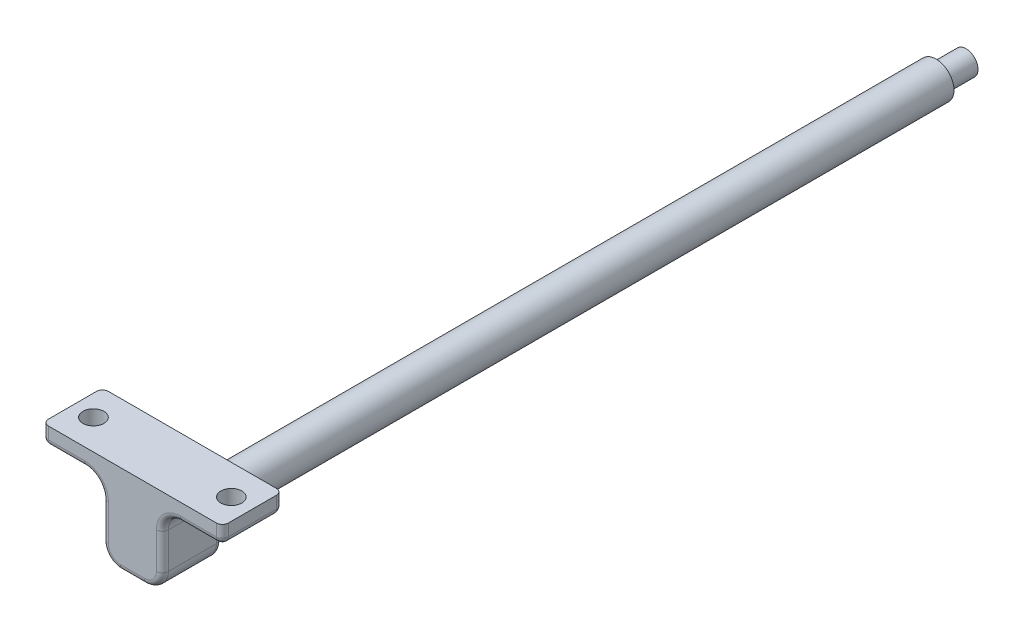
from build123d import *

# Parameters (mm, degrees)
SKETCH_1_R          = 3
EXTRUDE_1_DEPTH     = 124
SKETCH_2_R          = 2
EXTRUDE_2_DEPTH     = 5
SKETCH_4_W          = 10
SKETCH_4_H          = 3
EXTRUDE_4_DEPTH     = 10
FILLET_6_R          = 3
FILLET_7_R          = 1
SKETCH_5_R          = 1.75
CUT_EXTRUDE_1_DEPTH = 136.369863806
FILLET_8_R          = 1


with BuildPart() as part:
    # ｽｹｯﾁ1 → ﾎﾞｽ - 押し出し1 (new body)
    with BuildSketch(Plane.XY):
        Circle(SKETCH_1_R)
    extrude(amount=EXTRUDE_1_DEPTH)

    # ｽｹｯﾁ2 → ﾎﾞｽ - 押し出し2 (add)
    with BuildSketch(Plane(origin=(0, 0, 0), x_dir=(-1, 0, 0), z_dir=(0, 0, -1))):
        with Locations(Location((0, 0, 0), (0, 0, 180))):
            Circle(SKETCH_2_R)
    extrude(amount=EXTRUDE_2_DEPTH)


with BuildPart() as body_2:
    # ｽｹｯﾁ4 → ﾎﾞｽ - 押し出し4 (new body)
    with BuildSketch(Plane.XY.offset(124)):
        with Locations((10, 8.5)):
            Rectangle(SKETCH_4_W, SKETCH_4_H)
        with BuildLine():
            Line((5, 10), (0, 10))
            Line((0, 10), (0, 3))
            ThreePointArc((0, 3), (2.121320344, 2.121320344), (3, 0))
            ThreePointArc((3, 0), (2.121320344, -2.121320344), (0, -3))
            Line((0, -3), (0, -5))
            Line((0, -5), (5, -5))
            Line((5, -5), (5, 7))
            Line((5, 7), (5, 10))
        make_face()
        with BuildLine():
            Line((0, 3), (0, 10))
            Line((0, 10), (-5, 10))
            Line((-5, 10), (-5, 7))
            Line((-5, 7), (-5, -5))
            Line((-5, -5), (0, -5))
            Line((0, -5), (0, -3))
            ThreePointArc((0, -3), (-3, 0), (0, 3))
        make_face()
        with Locations((-10, 8.5)):
            Rectangle(SKETCH_4_W, SKETCH_4_H)
        with BuildLine():
            ThreePointArc((3, 0), (2.121320344, 2.121320344), (0, 3))
            Line((0, 3), (0, -3))
            ThreePointArc((0, -3), (2.121320344, -2.121320344), (3, 0))
        make_face()
        with BuildLine():
            Line((0, -3), (0, 3))
            ThreePointArc((0, 3), (-3, 0), (0, -3))
        make_face()
    extrude(amount=EXTRUDE_4_DEPTH)

    # ﾌｨﾚｯﾄ6
    fillet_6_edges = [body_2.edges().sort_by_distance(p)[0] for p in [
        (5, 7, 129),
        (5, -5, 129),
        (-5, -5, 129),
        (-5, 7, 129),
    ]]
    fillet(fillet_6_edges, radius=FILLET_6_R)

    # ﾌｨﾚｯﾄ7
    fillet_7_edges = [body_2.edges().sort_by_distance(p)[0] for p in [
        (15, 7, 129),
        (-15, 7, 129),
        (11.5, 7, 124),
        (11.5, 7, 134),
        (5, 1, 124),
        (5, 1, 134),
        (-5, 1, 124),
        (-5, 1, 134),
        (-11.5, 7, 124),
        (-11.5, 7, 134),
        (0, -5, 124),
        (-4.121320344, -4.121320344, 124),
        (4.121320344, -4.121320344, 124),
        (0, -5, 134),
        (-4.121320344, -4.121320344, 134),
        (4.121320344, -4.121320344, 134),
        (5.878679656, 6.121320344, 124),
        (5.878679656, 6.121320344, 134),
        (-5.878679656, 6.121320344, 124),
        (-5.878679656, 6.121320344, 134),
    ]]
    fillet(fillet_7_edges, radius=FILLET_7_R)

    # ｽｹｯﾁ5 → ｶｯﾄ - 押し出し1 (cut, through all)
    with BuildSketch(Plane(origin=(0, 7, 0), x_dir=(-1, 0, 0), z_dir=(0, -1, 0))):
        with Locations(Location((-11.5, -129, 0), (0, 0, 90))):
            Circle(SKETCH_5_R)
        with Locations(Location((11.5, -129, 0), (0, 0, 90))):
            Circle(SKETCH_5_R)
    extrude(amount=-CUT_EXTRUDE_1_DEPTH, mode=Mode.SUBTRACT)

    # ﾌｨﾚｯﾄ8
    # the kernel refuses this fillet: 1 mm, written as the material it takes off along each edge
    with BuildSketch(Plane(origin=(14, 8, 125), x_dir=(1, 0, 0), z_dir=(0, 0, -1))) as fillet_8_piece_1_section:
        Polygon((0, 0), (FILLET_8_R, 0), (FILLET_8_R, FILLET_8_R), (0, FILLET_8_R), align=None)
    fillet_8_piece_1 = extrude(amount=FILLET_8_R, mode=Mode.PRIVATE)
    fillet_8_piece_1 = fillet_8_piece_1 - Plane(origin=(14, 8, 125), x_dir=(-0.7071067811865472, 0.7071067811865477, 0), z_dir=(0, 0, -1)) * Sphere(FILLET_8_R, mode=Mode.PRIVATE)
    add(fillet_8_piece_1, mode=Mode.SUBTRACT)
    with BuildSketch(Plane(origin=(14, 8, 133), x_dir=(1, 0, 0), z_dir=(0, 0, 1))) as fillet_8_piece_2_section:
        Polygon((0, 0), (FILLET_8_R, 0), (FILLET_8_R, -FILLET_8_R), (0, -FILLET_8_R), align=None)
    fillet_8_piece_2 = extrude(amount=FILLET_8_R, mode=Mode.PRIVATE)
    fillet_8_piece_2 = fillet_8_piece_2 - Plane(origin=(14, 8, 133), x_dir=(-0.7071067811865472, 0.7071067811865477, 0), z_dir=(0, 0, 1)) * Sphere(FILLET_8_R, mode=Mode.PRIVATE)
    add(fillet_8_piece_2, mode=Mode.SUBTRACT)
    with BuildSketch(Plane(origin=(-14, 8, 125), x_dir=(-1, 0, 0), z_dir=(0, 0, -1))) as fillet_8_piece_3_section:
        Polygon((0, 0), (FILLET_8_R, 0), (FILLET_8_R, -FILLET_8_R), (0, -FILLET_8_R), align=None)
    fillet_8_piece_3 = extrude(amount=FILLET_8_R, mode=Mode.PRIVATE)
    fillet_8_piece_3 = fillet_8_piece_3 - Plane(origin=(-14, 8, 125), x_dir=(0.7071067811865472, 0.7071067811865477, 0), z_dir=(0, 0, -1)) * Sphere(FILLET_8_R, mode=Mode.PRIVATE)
    add(fillet_8_piece_3, mode=Mode.SUBTRACT)
    with BuildSketch(Plane(origin=(-14, 8, 133), x_dir=(-1, 0, 0), z_dir=(0, 0, 1))) as fillet_8_piece_4_section:
        Polygon((0, 0), (FILLET_8_R, 0), (FILLET_8_R, FILLET_8_R), (0, FILLET_8_R), align=None)
    fillet_8_piece_4 = extrude(amount=FILLET_8_R, mode=Mode.PRIVATE)
    fillet_8_piece_4 = fillet_8_piece_4 - Plane(origin=(-14, 8, 133), x_dir=(0.7071067811865472, 0.7071067811865477, 0), z_dir=(0, 0, 1)) * Sphere(FILLET_8_R, mode=Mode.PRIVATE)
    add(fillet_8_piece_4, mode=Mode.SUBTRACT)
    with BuildSketch(Plane(origin=(-15, 12.5, 124), x_dir=(1, 0, 0), z_dir=(0, -1, 0)), Plane(origin=(15, 8, 124), x_dir=(-1, 0, 0), z_dir=(0, 1, 0))) as fillet_8_piece_5:
        with BuildLine():
            CenterArc((FILLET_8_R, FILLET_8_R), FILLET_8_R, 180, 90)
            Line((0, FILLET_8_R), (0, 0))
            Line((0, 0), (FILLET_8_R, 0))
        make_face()
    extrude(amount=4.5, mode=Mode.SUBTRACT)
    with BuildSketch(Plane(origin=(-15, 12.5, 134), x_dir=(1, 0, 0), z_dir=(0, -1, 0)), Plane(origin=(15, 8, 134), x_dir=(-1, 0, 0), z_dir=(0, 1, 0))) as fillet_8_piece_6:
        with BuildLine():
            CenterArc((FILLET_8_R, -FILLET_8_R), FILLET_8_R, 90, 90)
            Line((0, -FILLET_8_R), (0, 0))
            Line((0, 0), (FILLET_8_R, 0))
        make_face()
    extrude(amount=4.5, mode=Mode.SUBTRACT)


solid = Compound([part.part, body_2.part])
